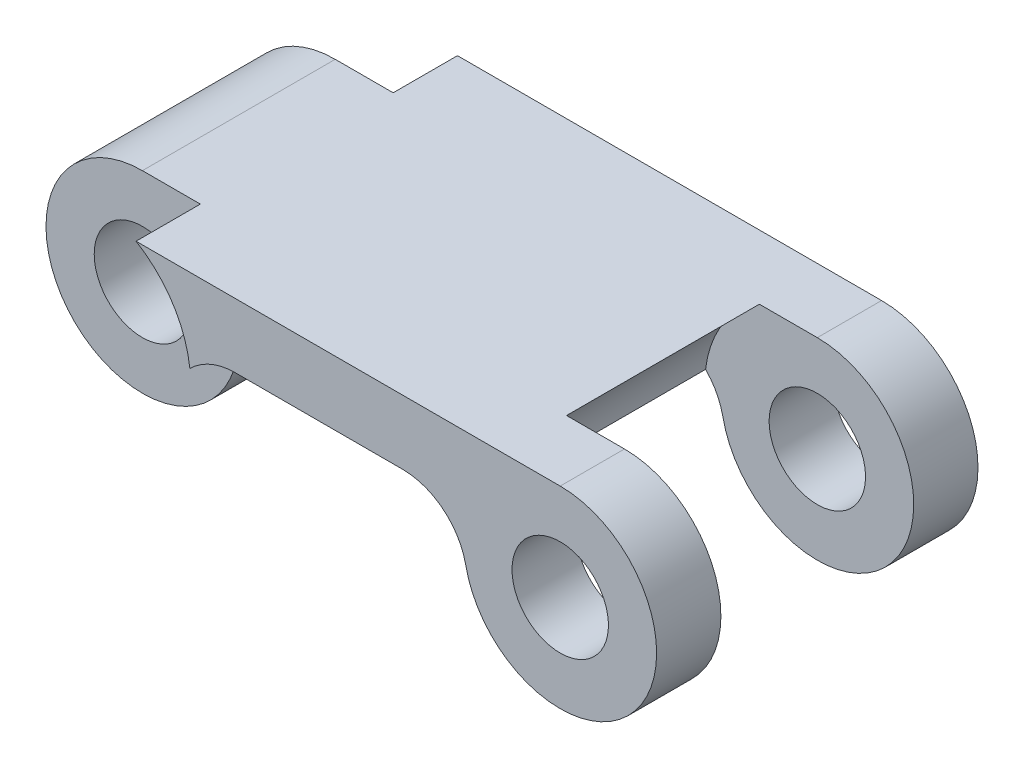
from build123d import *

# Parameters (mm, degrees)
ESTRUSIONE_ESTRUSIONE1_DEPTH = 10
SCHIZZO5_R                   = 1.499999999999997
SCHIZZO5_R_2                 = 1.5000000000000009
TAGLIO_ESTRUSIONE1_DEPTH     = 10
SCHIZZO6_R                   = 3.4999999999999996
TAGLIO_ESTRUSIONE2_DEPTH     = 2
TAGLIO_ESTRUSIONE3_START     = -8
SCHIZZO6_2_R                 = 3.4999999999999996
TAGLIO_ESTRUSIONE3_DEPTH     = 12
TAGLIO_ESTRUSIONE4_START     = -2
SCHIZZO7_R                   = 3.4999999999999996
TAGLIO_ESTRUSIONE4_DEPTH     = 6
RACCORDO1_R                  = 2
RACCORDO2_R                  = 2


with BuildPart() as part:
    # Schizzo1 → Estrusione-Estrusione1 (new body)
    with BuildSketch(Plane.XY):
        with BuildLine():
            Line((-24.824967096652905, 11.313668704827196), (-9.824967096652905, 11.313668704827196))
            ThreePointArc((-9.824967096652905, 11.313668704827196), (-8.092916289084027, 5.864178962044019), (-12.653394221399095, 9.313668704827194))
            Line((-12.653394221399095, 9.313668704827194), (-21.996539971906714, 9.313668704827194))
            ThreePointArc((-21.996539971906714, 9.313668704827194), (-26.557017904221784, 5.864178962044019), (-24.824967096652905, 11.313668704827196))
        make_face()
    extrude(amount=ESTRUSIONE_ESTRUSIONE1_DEPTH)

    # Schizzo5 → Taglio-Estrusione1 (cut)
    with BuildSketch(Plane(origin=(0, 0, 0), x_dir=(-1, 0, 0), z_dir=(0, 0, -1))):
        with Locations((9.824967096652905, 8.313668704827196)):
            Circle(SCHIZZO5_R)
        with Locations((24.824967096652905, 8.313668704827196)):
            Circle(SCHIZZO5_R_2)
    extrude(amount=-TAGLIO_ESTRUSIONE1_DEPTH, mode=Mode.SUBTRACT)

    # Schizzo6 → Taglio-Estrusione2 (cut)
    with BuildSketch(Plane(origin=(0, 0, 0), x_dir=(-1, 0, 0), z_dir=(0, 0, -1))):
        with Locations((24.824967096652905, 8.313668704827196)):
            Circle(SCHIZZO6_R)
    extrude(amount=-TAGLIO_ESTRUSIONE2_DEPTH, mode=Mode.SUBTRACT)

    # Schizzo6<2> → Taglio-Estrusione3 (cut)
    with BuildSketch(Plane(origin=(0, 0, 0), x_dir=(-1, 0, 0), z_dir=(0, 0, -1)).offset(TAGLIO_ESTRUSIONE3_START)):
        with Locations((24.824967096652905, 8.313668704827196)):
            Circle(SCHIZZO6_2_R)
    extrude(amount=-TAGLIO_ESTRUSIONE3_DEPTH, mode=Mode.SUBTRACT)

    # Schizzo7 → Taglio-Estrusione4 (cut)
    with BuildSketch(Plane(origin=(0, 0, 0), x_dir=(-1, 0, 0), z_dir=(0, 0, -1)).offset(TAGLIO_ESTRUSIONE4_START)):
        with Locations((9.824967096652905, 8.313668704827196)):
            Circle(SCHIZZO7_R)
    extrude(amount=-TAGLIO_ESTRUSIONE4_DEPTH, mode=Mode.SUBTRACT)

    # Raccordo1
    raccordo1_edges = [part.edges().sort_by_distance(p)[0] for p in [
        (-21.996539971906714, 9.313668704827194, 5),
    ]]
    fillet(raccordo1_edges, radius=RACCORDO1_R)

    # Raccordo2
    raccordo2_edges = [part.edges().sort_by_distance(p)[0] for p in [
        (-12.653394221399093, 9.313668704827194, 1),
    ]]
    fillet(raccordo2_edges, radius=RACCORDO2_R - 0.0001)  # a hair under: the kernel refuses the full size


solid = part.part
